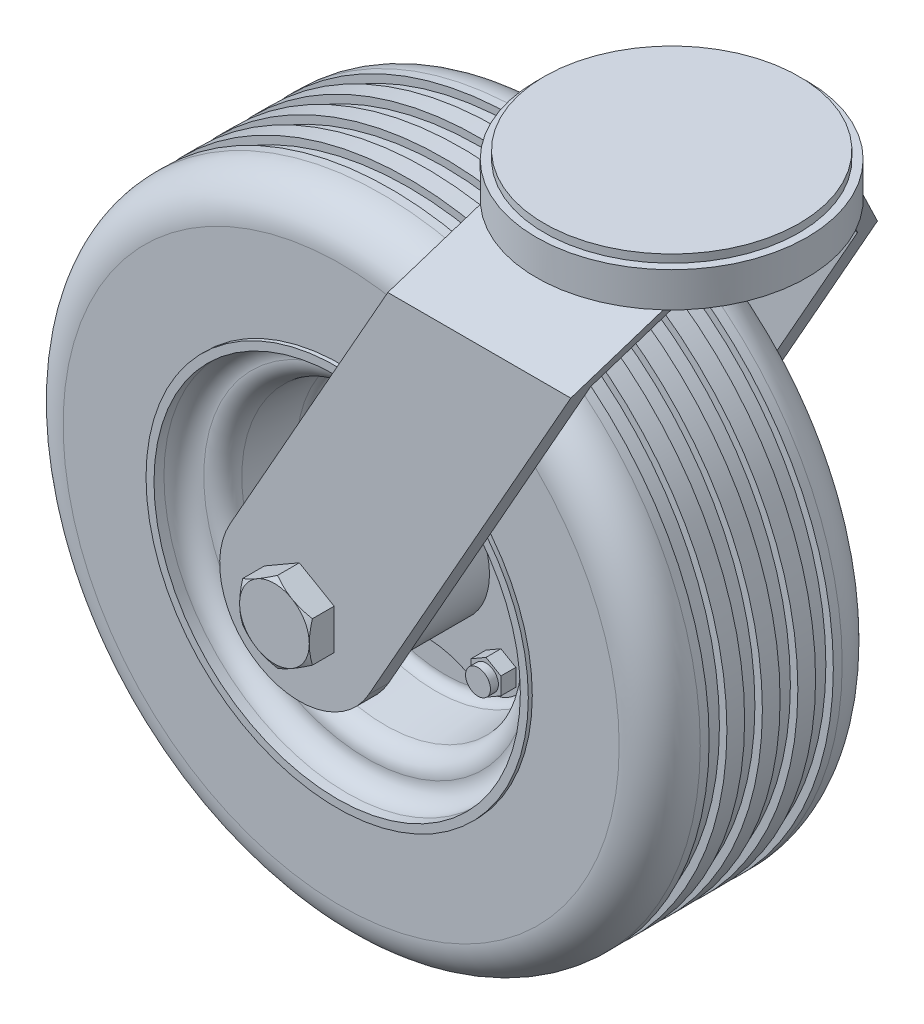
from build123d import *

# Parameters (mm, degrees)
SKETCH1_W               = 114.3
SKETCH1_H               = 6.35
BOSS_EXTRUDE1_DEPTH     = 50.8
F_1_2_HOLES_DEPTH       = 77.727341932
BOSS_EXTRUDE5_DEPTH     = 6.35
BOSS_EXTRUDE6_DEPTH     = 4.7625
SKETCH15_R              = 3.96875
BOSS_EXTRUDE7_DEPTH     = 2.54
SKETCH16_R              = 6.35
BOSS_EXTRUDE8_DEPTH     = 4.7625
SKETCH7_W               = 200.622007455
SKETCH7_H               = 97.79
BOSS_EXTRUDE2_DEPTH     = 225.2599
CUT_EXTRUDE1_START      = -97.79
CUT_EXTRUDE1_DEPTH      = 97.79
CUT_EXTRUDE3_DEPTH      = 230.782863468
CUT_EXTRUDE3_DEPTH_BACK = 230.782863468
SKETCH9_OUTSIDE_W       = 174.676
SKETCH9_OUTSIDE_H       = 325.489
BOSS_EXTRUDE3_DEPTH     = 7.9375
SKETCH11_OUTSIDE_W      = 1426.344
SKETCH11_OUTSIDE_H      = 1450.156
SKETCH11_OUTSIDE_R      = 11.1125
CUT_EXTRUDE4_DEPTH      = 324.561319865
CUT_EXTRUDE4_DRAFT      = -60
SKETCH12_R              = 10.795
BOSS_EXTRUDE4_DEPTH     = 85.09
SKETCH17_R              = 1441.45
CUT_EXTRUDE5_DEPTH      = 1397


# Read off the part's stored shape, not the designer's step: Cut-Extrude1
with BuildPart() as part:
    # Sketch1 → Boss-Extrude1 (new, symmetric)
    with BuildSketch(Plane.XY):
        with Locations((0, -3.175)):
            Rectangle(SKETCH1_W, SKETCH1_H)
    extrude(amount=BOSS_EXTRUDE1_DEPTH, both=True)

    # Sketch2 → 1-2 holes (cut, through all)
    with BuildSketch(Plane(origin=(0, 0, 0), x_dir=(1, 0, 0), z_dir=(0, 1, 0))):
        with BuildLine():
            Line((-35.649713965, 34.016189941), (-43.587213965, 29.253689941))
            ThreePointArc((-43.587213965, 29.253689941), (-50.121310059, 30.887213965), (-48.487786035, 37.421310059))
            Line((-48.487786035, 37.421310059), (-40.550286035, 42.183810059))
            ThreePointArc((-40.550286035, 42.183810059), (-34.016189941, 40.550286035), (-35.649713965, 34.016189941))
        make_face()
        with BuildLine():
            Line((-35.649713965, -34.016189941), (-43.587213965, -29.253689941))
            ThreePointArc((-43.587213965, -29.253689941), (-50.121310059, -30.887213965), (-48.487786035, -37.421310059))
            Line((-48.487786035, -37.421310059), (-40.550286035, -42.183810059))
            ThreePointArc((-40.550286035, -42.183810059), (-34.016189941, -40.550286035), (-35.649713965, -34.016189941))
        make_face()
        with BuildLine():
            Line((35.649713965, 34.016189941), (43.587213965, 29.253689941))
            ThreePointArc((43.587213965, 29.253689941), (50.121310059, 30.887213965), (48.487786035, 37.421310059))
            Line((48.487786035, 37.421310059), (40.550286035, 42.183810059))
            ThreePointArc((40.550286035, 42.183810059), (34.016189941, 40.550286035), (35.649713965, 34.016189941))
        make_face()
        with BuildLine():
            Line((35.649713965, -34.016189941), (43.587213965, -29.253689941))
            ThreePointArc((43.587213965, -29.253689941), (50.121310059, -30.887213965), (48.487786035, -37.421310059))
            Line((48.487786035, -37.421310059), (40.550286035, -42.183810059))
            ThreePointArc((40.550286035, -42.183810059), (34.016189941, -40.550286035), (35.649713965, -34.016189941))
        make_face()
    extrude(amount=-F_1_2_HOLES_DEPTH, mode=Mode.SUBTRACT)


with BuildPart() as body_2:
    # Sketch4 → Revolve1 (revolve)
    with BuildSketch(Plane.XY, mode=Mode.PRIVATE) as revolve1_sk:
        Polygon((0, -27.1526), (43.18, -27.1526), (43.18, -16.0401), (40.64, -16.0401), (40.64, -13.5001), (44.45, -13.5001), (44.45, -6.35), (0, -6.35), align=None)
    revolve(revolve1_sk.sketch.rotate(Axis((0, -6.35, 0), (0, -1, 0)), 180), axis=Axis((0, -6.35, 0), (0, -1, 0)))


with BuildPart() as body_3:
    # Sketch6 → Revolve2 (revolve)
    with BuildSketch(Plane(origin=(-69.85, 0, 0), x_dir=(0, 0, -1), z_dir=(1, 0, 0)), mode=Mode.PRIVATE) as revolve2_sk:
        with BuildLine():
            Line((-35.56, -89.8525), (-35.56, -62.143409091))
            ThreePointArc((-35.56, -62.143409091), (-31.772624414, -52.999875586), (-22.629090909, -49.2125))
            Line((-22.629090909, -49.2125), (-19.800454545, -49.2125))
            Line((-19.800454545, -49.2125), (-19.800454545, -51.59375))
            Line((-19.800454545, -51.59375), (-14.143181818, -51.59375))
            Line((-14.143181818, -51.59375), (-14.143181818, -49.2125))
            Line((-14.143181818, -49.2125), (-8.485909091, -49.2125))
            Line((-8.485909091, -49.2125), (-8.485909091, -51.59375))
            Line((-8.485909091, -51.59375), (-2.828636364, -51.59375))
            Line((-2.828636364, -51.59375), (-2.828636364, -49.2125))
            Line((-2.828636364, -49.2125), (2.828636364, -49.2125))
            Line((2.828636364, -49.2125), (2.828636364, -51.59375))
            Line((2.828636364, -51.59375), (8.485909091, -51.59375))
            Line((8.485909091, -51.59375), (8.485909091, -49.2125))
            Line((8.485909091, -49.2125), (14.143181818, -49.2125))
            Line((14.143181818, -49.2125), (14.143181818, -51.59375))
            Line((14.143181818, -51.59375), (19.800454545, -51.59375))
            Line((19.800454545, -51.59375), (19.800454545, -49.2125))
            Line((19.800454545, -49.2125), (22.629090909, -49.2125))
            ThreePointArc((22.629090909, -49.2125), (31.772624414, -52.999875586), (35.56, -62.143409091))
            Line((35.56, -62.143409091), (35.56, -89.8525))
            Line((35.56, -89.8525), (36.83, -89.8525))
            Line((36.83, -89.8525), (36.83, -92.3925))
            Line((36.83, -92.3925), (33.655, -92.3925))
            ThreePointArc((33.655, -92.3925), (29.164871939, -94.252371939), (27.305, -98.7425))
            ThreePointArc((27.305, -98.7425), (25.636711089, -103.032497818), (21.508438966, -105.068336333))
            Line((21.508438966, -105.068336333), (5.438280517, -106.474293018))
            ThreePointArc((5.438280517, -106.474293018), (3.374144456, -107.492212276), (2.54, -109.637211185))
            Line((2.54, -109.637211185), (2.54, -130.175))
            Line((2.54, -130.175), (36.83, -130.175))
            Line((36.83, -130.175), (40.005, -130.175))
            Line((40.005, -130.175), (40.005, -150.8125))
            Line((40.005, -150.8125), (-40.005, -150.8125))
            Line((-40.005, -150.8125), (-40.005, -130.175))
            Line((-40.005, -130.175), (-36.83, -130.175))
            Line((-36.83, -130.175), (-2.54, -130.175))
            Line((-2.54, -130.175), (-2.54, -109.637211185))
            ThreePointArc((-2.54, -109.637211185), (-3.374144456, -107.492212276), (-5.438280517, -106.474293018))
            Line((-5.438280517, -106.474293018), (-21.508438966, -105.068336333))
            ThreePointArc((-21.508438966, -105.068336333), (-25.636711089, -103.032497818), (-27.305, -98.7425))
            ThreePointArc((-27.305, -98.7425), (-29.164871939, -94.252371939), (-33.655, -92.3925))
            Line((-33.655, -92.3925), (-36.83, -92.3925))
            Line((-36.83, -92.3925), (-36.83, -89.8525))
            Line((-36.83, -89.8525), (-35.56, -89.8525))
        make_face()
    revolve(revolve2_sk.sketch.rotate(Axis((-69.85, -150.8125, 111.145303652), (0, 0, -1)), 90), axis=Axis((-69.85, -150.8125, 111.145303652), (0, 0, -1)))

    # Sketch13 → Boss-Extrude5 (add)
    with BuildSketch(Plane.XY.offset(2.54)):
        with BuildLine():
            ThreePointArc((-101.041813407, -136.474589407), (-98.965325939, -121.697174061), (-84.187910593, -119.620686593))
            ThreePointArc((-84.187910593, -119.620686593), (-69.85, -123.329070395), (-55.512089407, -119.620686593))
            ThreePointArc((-55.512089407, -119.620686593), (-40.734674061, -121.697174061), (-38.658186593, -136.474589407))
            ThreePointArc((-38.658186593, -136.474589407), (-42.366570395, -150.8125), (-38.658186593, -165.150410593))
            ThreePointArc((-38.658186593, -165.150410593), (-40.734674061, -179.927825939), (-55.512089407, -182.004313407))
            ThreePointArc((-55.512089407, -182.004313407), (-69.85, -178.295929605), (-84.187910593, -182.004313407))
            ThreePointArc((-84.187910593, -182.004313407), (-98.965325939, -179.927825939), (-101.041813407, -165.150410593))
            ThreePointArc((-101.041813407, -165.150410593), (-97.333429605, -150.8125), (-101.041813407, -136.474589407))
        make_face()
    extrude(amount=BOSS_EXTRUDE5_DEPTH)

    # Sketch14 → Boss-Extrude6 (add)
    with BuildSketch(Plane.XY.offset(8.89)):
        Polygon((-94.124522691, -132.037238623), (-89.362022691, -129.287607966), (-89.362022691, -123.788346652), (-94.124522691, -121.038715995), (-98.887022691, -123.788346652), (-98.887022691, -129.287607966), align=None)
        Polygon((-40.812977309, -129.287607966), (-45.575477309, -132.037238623), (-50.337977309, -129.287607966), (-50.337977309, -123.788346652), (-45.575477309, -121.038715995), (-40.812977309, -123.788346652), align=None)
        Polygon((-45.575477309, -169.587761377), (-50.337977309, -172.337392034), (-50.337977309, -177.836653348), (-45.575477309, -180.586284005), (-40.812977309, -177.836653348), (-40.812977309, -172.337392034), align=None)
        Polygon((-98.887022691, -172.337392034), (-94.124522691, -169.587761377), (-89.362022691, -172.337392034), (-89.362022691, -177.836653348), (-94.124522691, -180.586284005), (-98.887022691, -177.836653348), align=None)
    extrude(amount=BOSS_EXTRUDE6_DEPTH)

    # Sketch15 → Boss-Extrude7 (add)
    with BuildSketch(Plane.XY.offset(13.6525)):
        with Locations((-94.124522691, -126.537977309)):
            Circle(SKETCH15_R)
        with Locations(Location((-45.575477309, -126.537977309, 0), (0, 0, 180))):
            Circle(SKETCH15_R)
        with Locations(Location((-94.124522691, -175.087022691, 0), (0, 0, 180))):
            Circle(SKETCH15_R)
        with Locations((-45.575477309, -175.087022691)):
            Circle(SKETCH15_R)
    extrude(amount=BOSS_EXTRUDE7_DEPTH)

    # Sketch16 → Boss-Extrude8 (add)
    with BuildSketch(Plane(origin=(0, 0, -2.54), x_dir=(-1, 0, 0), z_dir=(0, 0, -1))):
        with Locations(Location((45.575477309, -126.537977309, 0), (0, 0, 180))):
            Circle(SKETCH16_R)
        with Locations(Location((94.124522691, -126.537977309, 0), (0, 0, 180))):
            Circle(SKETCH16_R)
        with Locations(Location((94.124522691, -175.087022691, 0), (0, 0, 180))):
            Circle(SKETCH16_R)
        with Locations(Location((45.575477309, -175.087022691, 0), (0, 0, 180))):
            Circle(SKETCH16_R)
    extrude(amount=BOSS_EXTRUDE8_DEPTH)


with BuildPart() as body_4:
    # Sketch7 → Boss-Extrude2 (new body)
    with BuildSketch(Plane.XZ.offset(27.1526)):
        with Locations((-71.138996273, 0)):
            Rectangle(SKETCH7_W, SKETCH7_H)
    extrude(amount=BOSS_EXTRUDE2_DEPTH)

    # Cut-Extrude1 outline → Cut-Extrude1 (cut)
    with BuildSketch(Plane.XY.offset(48.895).offset(CUT_EXTRUDE1_START)):
        with BuildLine():
            Line((29.172007455, -27.1526), (-47.734278242, -163.304691606))
            ThreePointArc((-47.734278242, -163.304691606), (-82.342191606, -172.928221758), (-91.965721758, -138.320308394))
            Line((-91.965721758, -138.320308394), (-29.172007455, -27.1526))
            Line((-29.172007455, -27.1526), (-171.45, -27.1526))
            Line((-171.45, -27.1526), (-171.45, -252.4125))
            Line((-171.45, -252.4125), (29.172007455, -252.4125))
            Line((29.172007455, -252.4125), (29.172007455, -27.1526))
        make_face()
    extrude(amount=CUT_EXTRUDE1_DEPTH, mode=Mode.SUBTRACT)

    # Sketch9 outside → Cut-Extrude3 (cut, two sides: drawn at the far end of the back side and taken through both)
    with BuildSketch(Plane(origin=(0, -144.306693689, 0), x_dir=(0, 0, -1), z_dir=(-1, 0, 0)).offset(-CUT_EXTRUDE3_DEPTH_BACK)):
        with Locations((0, -18.1005)):
            Rectangle(SKETCH9_OUTSIDE_W, SKETCH9_OUTSIDE_H)
        Polygon((48.895, 108.105806311), (48.895, -95.094193689), (31.835614978, -117.154093689), (25.485614978, -117.154093689), (42.545, -95.094193689), (42.545, 108.105806311), align=None, mode=Mode.SUBTRACT)
        Polygon((-25.485614978, -117.154093689), (-31.835614978, -117.154093689), (-48.895, -95.094193689), (-48.895, 108.105806311), (-42.545, 108.105806311), (-42.545, -95.094193689), align=None, mode=Mode.SUBTRACT)
    extrude(amount=CUT_EXTRUDE3_DEPTH + CUT_EXTRUDE3_DEPTH_BACK, mode=Mode.SUBTRACT)


with BuildPart() as cut_extrude3_piece_1:
    # of the separate pieces the step leaves, piece 1, a body of its own (cut_extrude3_pieces)
    add(body_4.part.solids().sort_by_distance((29.172007455, -27.1526, -31.835614978))[0])



with BuildPart() as cut_extrude3_piece_2:
    # of the separate pieces the step leaves, piece 2, a body of its own (cut_extrude3_pieces)
    add(body_4.part.solids().sort_by_distance((16.711347087, -49.2125, 48.895))[0])


with BuildPart() as body_6:
    # Sketch10 → Boss-Extrude3 (new body)
    with BuildSketch(Plane.XY.offset(48.895)):
        Polygon((-69.85, -137.980890267), (-80.9625, -144.396695134), (-80.9625, -157.228304866), (-69.85, -163.644109733), (-58.7375, -157.228304866), (-58.7375, -144.396695134), align=None)
    extrude(amount=BOSS_EXTRUDE3_DEPTH)


with BuildPart() as cut_extrude4_tool:
    # Sketch11 outside → Cut-Extrude4 (with draft: the straight prism first)
    with BuildSketch(Plane.XY.offset(56.8325)):
        with Locations((-57.15, -126.206)):
            Rectangle(SKETCH11_OUTSIDE_W, SKETCH11_OUTSIDE_H)
        with Locations((-69.85, -150.8125)):
            Circle(SKETCH11_OUTSIDE_R, mode=Mode.SUBTRACT)
    extrude(amount=-CUT_EXTRUDE4_DEPTH)
    # Cut-Extrude4: the draft: its side faces are tilted about the plane it starts from
    cut_extrude4_sides = [cut_extrude4_tool.faces().sort_by_distance(p)[0] for p in [
        (-57.15, -851.284, -105.448159932),
        (656.022, -126.206, -105.448159932),
        (-57.15, 598.872, -105.448159932),
        (-770.322, -126.206, -105.448159932),
        (-80.9625, -150.8125, -105.448159932),
    ]]
    draft(cut_extrude4_sides, Plane.XY.offset(56.8325), CUT_EXTRUDE4_DRAFT)


with BuildPart() as body_6_1:
    add(body_6.part)

    # Cut-Extrude4: cut by cut_extrude4_tool
    add(cut_extrude4_tool.part, mode=Mode.SUBTRACT)


with BuildPart() as body_7:
    # Mirror1: mirrored copy
    add(body_6_1.part.mirror(Plane.XY))


with BuildPart() as cut_extrude3_piece_1_1:
    add(cut_extrude3_piece_1.part)

    add(cut_extrude3_piece_2.part)  # Boss-Extrude4 merges Cut-Extrude3 piece 2
    # Sketch12 → Boss-Extrude4 (add)
    with BuildSketch(Plane.XY.offset(-42.545)):
        with Locations(Location((-69.85, -150.8125, 0), (0, 0, 180))):
            Circle(SKETCH12_R)
    extrude(amount=BOSS_EXTRUDE4_DEPTH)

    # Combine1: union body 7, body 6, body 2, part
    add(body_7.part)
    add(body_6_1.part)
    add(body_2.part)
    add(part.part)

    # Sketch17 → Cut-Extrude5 (cut)
    with BuildSketch(Plane.XZ.offset(13.5001)):
        Circle(SKETCH17_R)
    extrude(amount=-CUT_EXTRUDE5_DEPTH, mode=Mode.SUBTRACT)


solid = Compound([body_3.part, cut_extrude3_piece_1_1.part])
